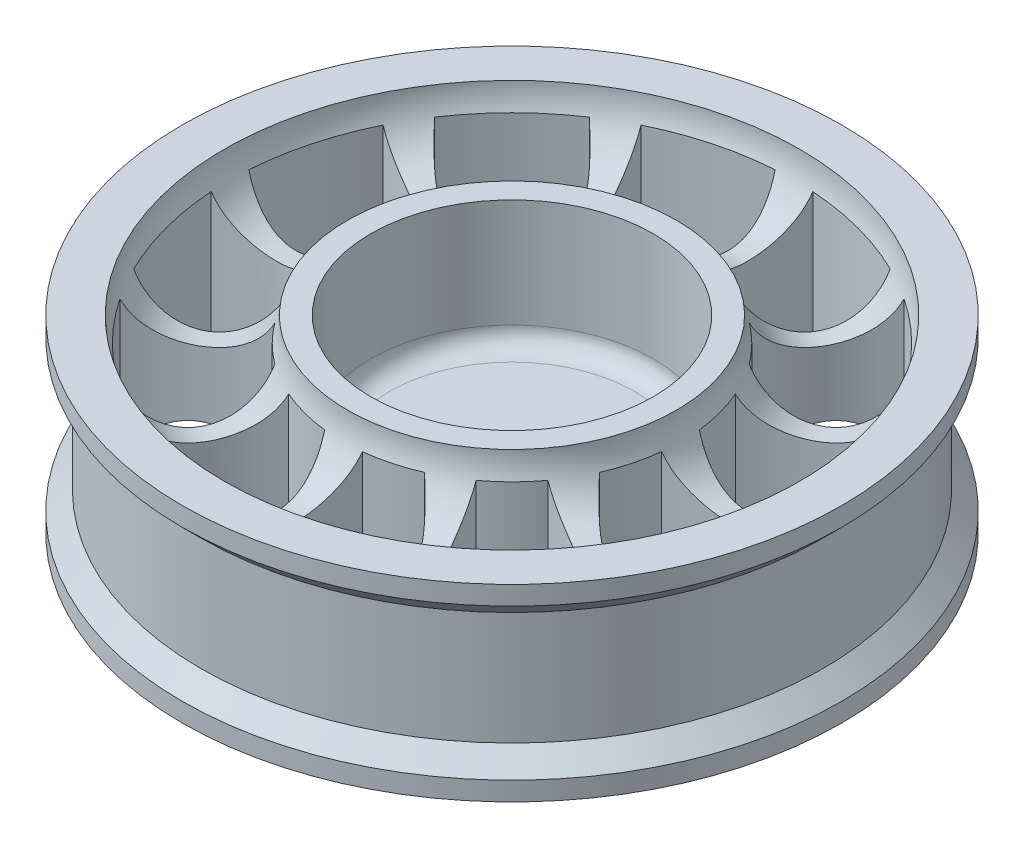
from build123d import *

# Parameters (mm, degrees)
SKETCH2_R            = 35
BOSS_EXTRUDE1_DEPTH  = 20
SKETCH3_R            = 15
CUT_EXTRUDE1_DEPTH   = 13.5
SKETCH4_R            = 1.35
CUT_EXTRUDE2_DEPTH   = 54.38539126
CUT_EXTRUDE3_DEPTH   = 5
SKETCH6_R            = 35
SKETCH6_R_2          = 33
CUT_EXTRUDE5_DEPTH   = 8
CUT_EXTRUDE8_REACH   = 55.385
SKETCH8_R            = 30
SKETCH8_R_2          = 18
BOSS_EXTRUDE2_DEPTH  = 20
CUT_SWEEP1_PROFILE_R = 6.53776246
FILLET1_R            = 2
CHAMFER1_SIZE        = 2


with BuildPart() as part:
    # Sketch2 → Boss-Extrude1 (new body)
    with BuildSketch(Plane(origin=(0, 0, 0), x_dir=(1, 0, 0), z_dir=(0, 1, 0))):
        with Locations(Location((0, 0, 0), (0, 0, 270))):
            Circle(SKETCH2_R)
    extrude(amount=BOSS_EXTRUDE1_DEPTH)

    # Sketch3 → Cut-Extrude1 (cut)
    with BuildSketch(Plane(origin=(0, 20, 0), x_dir=(1, 0, 0), z_dir=(0, 1, 0))):
        with Locations(Location((0, 0, 0), (0, 0, 270))):
            Circle(SKETCH3_R)
    extrude(amount=-CUT_EXTRUDE1_DEPTH, mode=Mode.SUBTRACT)

    # Sketch4 → Cut-Extrude2 (cut, through all)
    with BuildSketch(Plane.XZ):
        with Locations(Location((0, 0, 0), (0, 0, 270))):
            Circle(SKETCH4_R)
    extrude(amount=-CUT_EXTRUDE2_DEPTH, mode=Mode.SUBTRACT)

    # Sketch5 → Cut-Extrude3 (cut)
    with BuildSketch(Plane.XZ):
        Polygon((2.54, 0), (1.27, 2.199704526), (-1.27, 2.199704526), (-2.54, 0), (-1.27, -2.199704526), (1.27, -2.199704526), align=None)
    extrude(amount=-CUT_EXTRUDE3_DEPTH, mode=Mode.SUBTRACT)

    # Sketch6 → Cut-Extrude5 (cut, symmetric)
    with BuildSketch(Plane(origin=(0, 10, 0), x_dir=(1, 0, 0), z_dir=(0, 1, 0))):
        with Locations(Location((0, 0, 0), (0, 0, 270))):
            Circle(SKETCH6_R)
        with Locations(Location((0, 0, 0), (0, 0, 270))):
            Circle(SKETCH6_R_2, mode=Mode.SUBTRACT)
    extrude(amount=CUT_EXTRUDE5_DEPTH, both=True, mode=Mode.SUBTRACT)

    # Sketch8 → Cut-Extrude8 (cut, up to next)
    with BuildSketch(Plane(origin=(0, 20, 0), x_dir=(1, 0, 0), z_dir=(0, 1, 0)), mode=Mode.PRIVATE) as cut_extrude8_sk1:
        with Locations(Location((0, 0, 0), (0, 0, 270))):
            Circle(SKETCH8_R)
        with Locations(Location((0, 0, 0), (0, 0, 270))):
            Circle(SKETCH8_R_2, mode=Mode.SUBTRACT)
    cut_extrude8_tool1 = extrude(cut_extrude8_sk1.sketch, amount=-CUT_EXTRUDE8_REACH, mode=Mode.PRIVATE) & part.part
    add(cut_extrude8_tool1.solids().sort_by_distance((0, 20, -29.151472))[0], mode=Mode.SUBTRACT)


with BuildPart() as cut_extrude8_piece_1:
    # of the separate pieces the step leaves, piece 1, a body of its own (cut_extrude8_pieces)
    add(part.part.solids().sort_by_distance((0, 0, 35))[0])



with BuildPart() as cut_extrude8_piece_2:
    # of the separate pieces the step leaves, piece 2, a body of its own (cut_extrude8_pieces)
    add(part.part.solids().sort_by_distance((0, 0, 18))[0])


with BuildPart() as cut_extrude8_piece_1_1:
    add(cut_extrude8_piece_1.part)

    add(cut_extrude8_piece_2.part)  # Boss-Extrude2 merges Cut-Extrude8 piece 2
    # Sketch11 → Boss-Extrude2 (add)
    with BuildSketch(Plane.XZ):
        with BuildLine():
            ThreePointArc((2, 17.88854382), (0, 18), (-2, 17.88854382))
            add(Edge.make_bspline(
                [(-2, 29.933259094), (0, 23.910901457), (-2, 17.88854382)],
                knots=[0, 0, 0, 1, 1, 1], degree=2))
            ThreePointArc((-2, 29.933259094), (0, 30), (2, 29.933259094))
            add(Edge.make_bspline(
                [(2, 29.933259094), (0, 23.910901457), (2, 17.88854382)],
                knots=[0, 0, 0, 1, 1, 1], degree=2))
        make_face()
        with BuildLine():
            ThreePointArc((10.676322718, 14.491933385), (9, 15.588457268), (7.212221102, 16.491933385))
            add(Edge.make_bspline(
                [(13.23457874, 26.922962794), (11.955450729, 20.707448089), (7.212221102, 16.491933385)],
                knots=[0, 0, 0, 1, 1, 1], degree=2))
            ThreePointArc((13.23457874, 26.922962794), (15, 25.980762114), (16.698680355, 24.922962794))
            add(Edge.make_bspline(
                [(16.698680355, 24.922962794), (11.955450729, 20.707448089), (10.676322718, 14.491933385)],
                knots=[0, 0, 0, 1, 1, 1], degree=2))
        make_face()
        with BuildLine():
            ThreePointArc((16.491933385, 7.212221102), (15.588457268, 9), (14.491933385, 10.676322718))
            add(Edge.make_bspline(
                [(24.922962794, 16.698680355), (20.707448089, 11.955450729), (14.491933385, 10.676322718)],
                knots=[0, 0, 0, 1, 1, 1], degree=2))
            ThreePointArc((24.922962794, 16.698680355), (25.980762114, 15), (26.922962794, 13.23457874))
            add(Edge.make_bspline(
                [(26.922962794, 13.23457874), (20.707448089, 11.955450729), (16.491933385, 7.212221102)],
                knots=[0, 0, 0, 1, 1, 1], degree=2))
        make_face()
        with BuildLine():
            ThreePointArc((17.88854382, -2), (18, 0), (17.88854382, 2))
            add(Edge.make_bspline(
                [(29.933259094, 2), (23.910901457, 0), (17.88854382, 2)],
                knots=[0, 0, 0, 1, 1, 1], degree=2))
            ThreePointArc((29.933259094, 2), (30, 0), (29.933259094, -2))
            add(Edge.make_bspline(
                [(29.933259094, -2), (23.910901457, 0), (17.88854382, -2)],
                knots=[0, 0, 0, 1, 1, 1], degree=2))
        make_face()
        with BuildLine():
            ThreePointArc((14.491933385, -10.676322718), (15.588457268, -9), (16.491933385, -7.212221102))
            add(Edge.make_bspline(
                [(26.922962794, -13.23457874), (20.707448089, -11.955450729), (16.491933385, -7.212221102)],
                knots=[0, 0, 0, 1, 1, 1], degree=2))
            ThreePointArc((26.922962794, -13.23457874), (25.980762114, -15), (24.922962794, -16.698680355))
            add(Edge.make_bspline(
                [(24.922962794, -16.698680355), (20.707448089, -11.955450729), (14.491933385, -10.676322718)],
                knots=[0, 0, 0, 1, 1, 1], degree=2))
        make_face()
        with BuildLine():
            ThreePointArc((7.212221102, -16.491933385), (9, -15.588457268), (10.676322718, -14.491933385))
            add(Edge.make_bspline(
                [(16.698680355, -24.922962794), (11.955450729, -20.707448089), (10.676322718, -14.491933385)],
                knots=[0, 0, 0, 1, 1, 1], degree=2))
            ThreePointArc((16.698680355, -24.922962794), (15, -25.980762114), (13.23457874, -26.922962794))
            add(Edge.make_bspline(
                [(13.23457874, -26.922962794), (11.955450729, -20.707448089), (7.212221102, -16.491933385)],
                knots=[0, 0, 0, 1, 1, 1], degree=2))
        make_face()
        with BuildLine():
            ThreePointArc((-2, -17.88854382), (0, -18), (2, -17.88854382))
            add(Edge.make_bspline(
                [(2, -29.933259094), (0, -23.910901457), (2, -17.88854382)],
                knots=[0, 0, 0, 1, 1, 1], degree=2))
            ThreePointArc((2, -29.933259094), (0, -30), (-2, -29.933259094))
            add(Edge.make_bspline(
                [(-2, -29.933259094), (0, -23.910901457), (-2, -17.88854382)],
                knots=[0, 0, 0, 1, 1, 1], degree=2))
        make_face()
        with BuildLine():
            ThreePointArc((-10.676322718, -14.491933385), (-9, -15.588457268), (-7.212221102, -16.491933385))
            add(Edge.make_bspline(
                [(-13.23457874, -26.922962794), (-11.955450729, -20.707448089), (-7.212221102, -16.491933385)],
                knots=[0, 0, 0, 1, 1, 1], degree=2))
            ThreePointArc((-13.23457874, -26.922962794), (-15, -25.980762114), (-16.698680355, -24.922962794))
            add(Edge.make_bspline(
                [(-16.698680355, -24.922962794), (-11.955450729, -20.707448089), (-10.676322718, -14.491933385)],
                knots=[0, 0, 0, 1, 1, 1], degree=2))
        make_face()
        with BuildLine():
            ThreePointArc((-16.491933385, -7.212221102), (-15.588457268, -9), (-14.491933385, -10.676322718))
            add(Edge.make_bspline(
                [(-24.922962794, -16.698680355), (-20.707448089, -11.955450729), (-14.491933385, -10.676322718)],
                knots=[0, 0, 0, 1, 1, 1], degree=2))
            ThreePointArc((-24.922962794, -16.698680355), (-25.980762114, -15), (-26.922962794, -13.23457874))
            add(Edge.make_bspline(
                [(-26.922962794, -13.23457874), (-20.707448089, -11.955450729), (-16.491933385, -7.212221102)],
                knots=[0, 0, 0, 1, 1, 1], degree=2))
        make_face()
        with BuildLine():
            ThreePointArc((-17.88854382, 2), (-18, 0), (-17.88854382, -2))
            add(Edge.make_bspline(
                [(-29.933259094, -2), (-23.910901457, 0), (-17.88854382, -2)],
                knots=[0, 0, 0, 1, 1, 1], degree=2))
            ThreePointArc((-29.933259094, -2), (-30, 0), (-29.933259094, 2))
            add(Edge.make_bspline(
                [(-29.933259094, 2), (-23.910901457, 0), (-17.88854382, 2)],
                knots=[0, 0, 0, 1, 1, 1], degree=2))
        make_face()
        with BuildLine():
            ThreePointArc((-14.491933385, 10.676322718), (-15.588457268, 9), (-16.491933385, 7.212221102))
            add(Edge.make_bspline(
                [(-26.922962794, 13.23457874), (-20.707448089, 11.955450729), (-16.491933385, 7.212221102)],
                knots=[0, 0, 0, 1, 1, 1], degree=2))
            ThreePointArc((-26.922962794, 13.23457874), (-25.980762114, 15), (-24.922962794, 16.698680355))
            add(Edge.make_bspline(
                [(-24.922962794, 16.698680355), (-20.707448089, 11.955450729), (-14.491933385, 10.676322718)],
                knots=[0, 0, 0, 1, 1, 1], degree=2))
        make_face()
        with BuildLine():
            ThreePointArc((-7.212221102, 16.491933385), (-9, 15.588457268), (-10.676322718, 14.491933385))
            add(Edge.make_bspline(
                [(-16.698680355, 24.922962794), (-11.955450729, 20.707448089), (-10.676322718, 14.491933385)],
                knots=[0, 0, 0, 1, 1, 1], degree=2))
            ThreePointArc((-16.698680355, 24.922962794), (-15, 25.980762114), (-13.23457874, 26.922962794))
            add(Edge.make_bspline(
                [(-13.23457874, 26.922962794), (-11.955450729, 20.707448089), (-7.212221102, 16.491933385)],
                knots=[0, 0, 0, 1, 1, 1], degree=2))
        make_face()
    extrude(amount=-BOSS_EXTRUDE2_DEPTH)

    # Cut-Sweep1: sweep along a path in Sketch12
    with BuildLine(Plane(origin=(0, 0, 0), x_dir=(-1, 0, 0), z_dir=(0, -1, 0))) as cut_sweep1_path:
        CenterArc((0, 0), 24, 0, 360)
    # Cut-Sweep1 profile (on start of the path) → Cut-Sweep1 (sweep, cut)
    with BuildSketch(Plane(origin=(-24, 0, 0), x_dir=(-1, 0, 0), z_dir=(0, 0, -1))):
        Circle(CUT_SWEEP1_PROFILE_R)
    cut_sweep1 = sweep(path=cut_sweep1_path.line, mode=Mode.SUBTRACT)

    # Mirror1: Cut-Sweep1 across plane
    add(cut_sweep1.mirror(Plane.ZX.offset(10)), mode=Mode.SUBTRACT)

    # Fillet1
    fillet1_edges = [cut_extrude8_piece_1_1.edges().sort_by_distance(p)[0] for p in [
        (0, 6.5, -15),
    ]]
    fillet(fillet1_edges, radius=FILLET1_R)

    # Chamfer1
    chamfer1_edges = [cut_extrude8_piece_1_1.edges().sort_by_distance(p)[0] for p in [
        (0, 18, -33),
        (0, 2, -33),
    ]]
    chamfer(chamfer1_edges, length=CHAMFER1_SIZE - 0.0001)  # a hair under: the kernel refuses the full size


solid = cut_extrude8_piece_1_1.part
